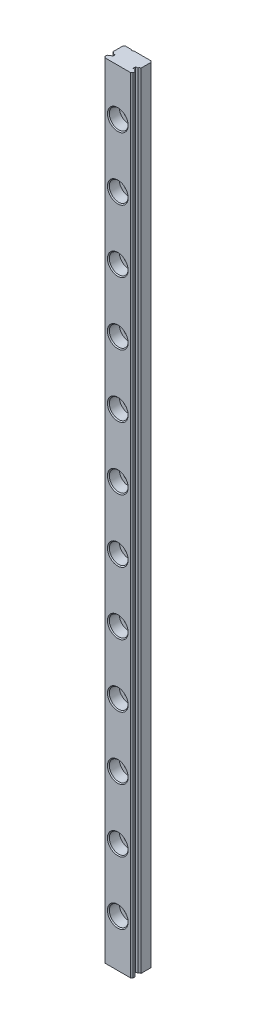
from build123d import *

# Parameters (mm, degrees)
DELKA_DEPTH       = 250
D_RA1_D           = 3.5
D_RA1_CBORE_D     = 6
D_RA1_CBORE_DEPTH = 3.5
LINPOLE1_COUNT    = 12
LINPOLE1_PITCH    = 20


with BuildPart() as part:
    # Skica1 → Delka (new body)
    with BuildSketch(Plane(origin=(0, 0, 0), x_dir=(1, 0, 0), z_dir=(0, 1, 0))):
        with BuildLine():
            Line((-4.1, -6.500009514), (4.1, -6.500009514))
            Line((4.1, -6.500009514), (4.5, -6.100009514))
            Line((4.5, -6.100009514), (4.5, -5.453944278))
            ThreePointArc((4.5, -5.453944278), (4.150323615, -5.260214834), (3.904469431, -4.945))
            Line((3.904469431, -4.945), (3.3, -4.890009514))
            Line((3.3, -4.890009514), (3.3, -4.110009514))
            Line((3.3, -4.110009514), (3.909510964, -4.045014121))
            ThreePointArc((3.909510964, -4.045014121), (4.154592253, -3.736176828), (4.5, -3.546074751))
            Line((4.5, -3.546074751), (4.5, -0.4))
            Line((4.5, -0.4), (4.1, 0))
            Line((4.1, 0), (-1.4, 0))
            ThreePointArc((-1.4, 0), (-1.8, -0.2), (-2.2, 0))
            Line((-2.2, 0), (-4.1, 0))
            Line((-4.1, 0), (-4.5, -0.4))
            Line((-4.5, -0.4), (-4.5, -3.546074751))
            ThreePointArc((-4.5, -3.546074751), (-4.154592253, -3.736176828), (-3.909510964, -4.045014121))
            Line((-3.909510964, -4.045014121), (-3.3, -4.110009514))
            Line((-3.3, -4.110009514), (-3.3, -4.890009514))
            Line((-3.3, -4.890009514), (-3.904469431, -4.945))
            ThreePointArc((-3.904469431, -4.945), (-4.150323615, -5.260214834), (-4.5, -5.453944278))
            Line((-4.5, -5.453944278), (-4.5, -6.100009514))
            Line((-4.5, -6.100009514), (-4.1, -6.500009514))
        make_face()
    extrude(amount=DELKA_DEPTH)

    # Díra1 (through all)
    with Locations(Plane.XY.offset(6.500009514)):
        with Locations((0, 15)):
            d_ra1 = CounterBoreHole(D_RA1_D / 2, D_RA1_CBORE_D / 2, D_RA1_CBORE_DEPTH)

    # Zkosení1: read off the stored shape, not the designer's step
    # Zkosení1 outline → Zkosení1 (revolve, cut)
    with BuildSketch(Plane.XZ.offset(-15)):
        Polygon((2.050000176, -1.76e-07), (1.75, 0.3), (1.75, -1.76e-07), align=None)
        Polygon((3, 6.500009514), (3, 6.200009514), (3.3, 6.500009514), align=None)
    zkosen_1 = revolve(axis=Axis((0, 15, 0), (0, 0, 1)), mode=Mode.SUBTRACT)

    # LinPole1: Díra1, Zkosení1 ×12
    with Locations(*[(0, i * LINPOLE1_PITCH, 0) for i in range(1, LINPOLE1_COUNT)]):
        add(d_ra1, mode=Mode.SUBTRACT)
        add(zkosen_1, mode=Mode.SUBTRACT)


solid = part.part
